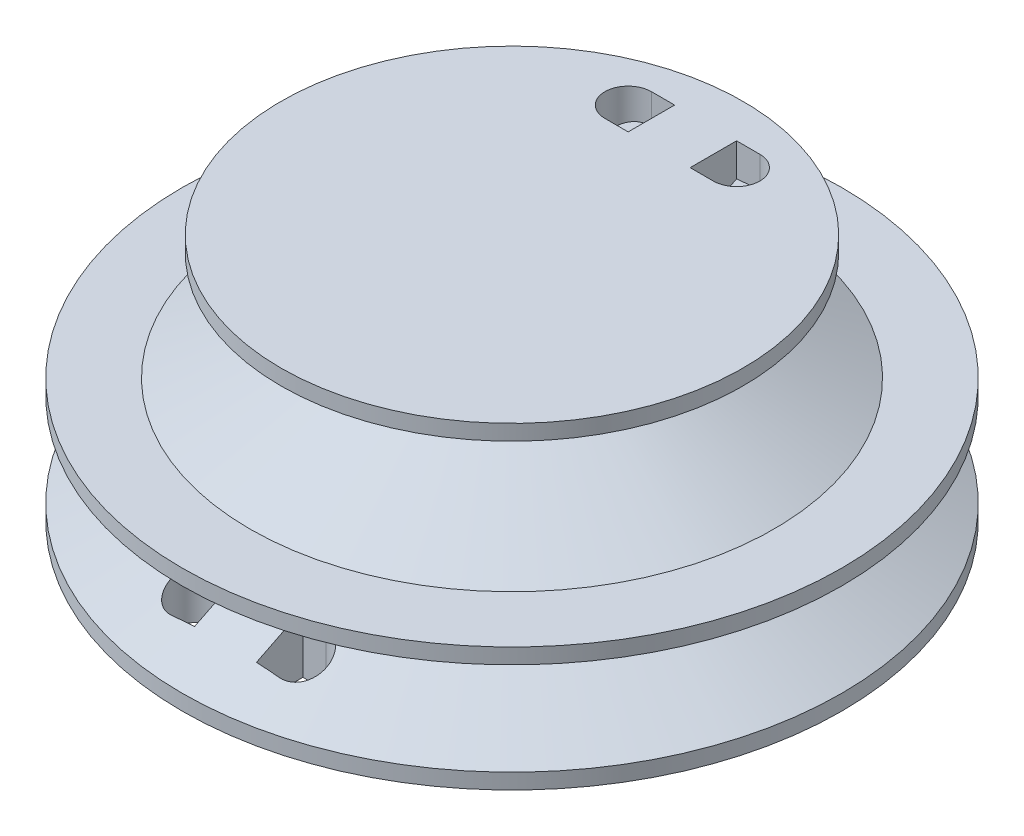
from build123d import *

# Parameters (mm, degrees)
SKETCH_24_R         = 7.643312102
BOSS_EXTRUDE1_DEPTH = 4
SKETCH5_R           = 4.458598726
BOSS_EXTRUDE2_DEPTH = 4
CUT_EXTRUDE2_DEPTH  = 2
CUT_EXTRUDE3_DEPTH  = 2


with BuildPart() as part:
    # Sketch 24 → Boss-Extrude1 (new body)
    with BuildSketch(Plane(origin=(0, 0, 0), x_dir=(1, 0, 0), z_dir=(0, 1, 0))):
        Circle(SKETCH_24_R)
    extrude(amount=BOSS_EXTRUDE1_DEPTH)

    # Sketch3 → Revolve1 (revolve)
    with BuildSketch(Plane.XY):
        Polygon((-7.643312102, 2), (-7.643312102, 4), (-10.643312102, 4), (-10.643312102, 3.5), align=None)
        Polygon((-7.643312102, 0), (-7.643312102, 2), (-10.643312102, 0.5), (-10.643312102, 0), align=None)
    revolve(axis=Axis((0, 4, 0), (0, -1, 0)))

    # Sketch5 → Boss-Extrude2 (add)
    with BuildSketch(Plane(origin=(0, 4, 0), x_dir=(1, 0, 0), z_dir=(0, 1, 0))):
        Circle(SKETCH5_R)
    extrude(amount=BOSS_EXTRUDE2_DEPTH)

    # Sketch6 → Revolve2 (revolve)
    with BuildSketch(Plane.XY):
        Polygon((-4.458598726, 6), (-4.458598726, 8), (-7.458598726, 8), (-7.458598726, 7.5), align=None)
        Polygon((-4.458598726, 4), (-4.458598726, 6), (-8.458598726, 4), align=None)
    revolve(axis=Axis((0, 4, 0), (0, -1, 0)))

    # Sketch8 → Cut-Extrude2 (cut)
    with BuildSketch(Plane.XZ):
        with BuildLine():
            Line((-1, 9.25), (-1.75, 9.25))
            ThreePointArc((-1.75, 9.25), (-2.5, 8.5), (-1.75, 7.75))
            Line((-1.75, 7.75), (-1, 7.75))
            Line((-1, 7.75), (-1, 9.25))
        make_face()
        with BuildLine():
            Line((1.75, 9.25), (1, 9.25))
            Line((1, 9.25), (1, 7.75))
            Line((1, 7.75), (1.75, 7.75))
            ThreePointArc((1.75, 7.75), (2.5, 8.5), (1.75, 9.25))
        make_face()
    extrude(amount=-CUT_EXTRUDE2_DEPTH, mode=Mode.SUBTRACT)

    # Sketch9 → Cut-Extrude3 (cut)
    with BuildSketch(Plane(origin=(0, 8, -8), x_dir=(-1, 0, 0), z_dir=(0, -1, 0))):
        with BuildLine():
            Line((-1, -1.75), (-1.75, -1.75))
            ThreePointArc((-1.75, -1.75), (-2.5, -2.5), (-1.75, -3.25))
            Line((-1.75, -3.25), (-1, -3.25))
            Line((-1, -3.25), (-1, -1.75))
        make_face()
        with BuildLine():
            Line((1.75, -1.75), (1, -1.75))
            Line((1, -1.75), (1, -3.25))
            Line((1, -3.25), (1.75, -3.25))
            ThreePointArc((1.75, -3.25), (2.5, -2.5), (1.75, -1.75))
        make_face()
    extrude(amount=CUT_EXTRUDE3_DEPTH, mode=Mode.SUBTRACT)


solid = part.part
